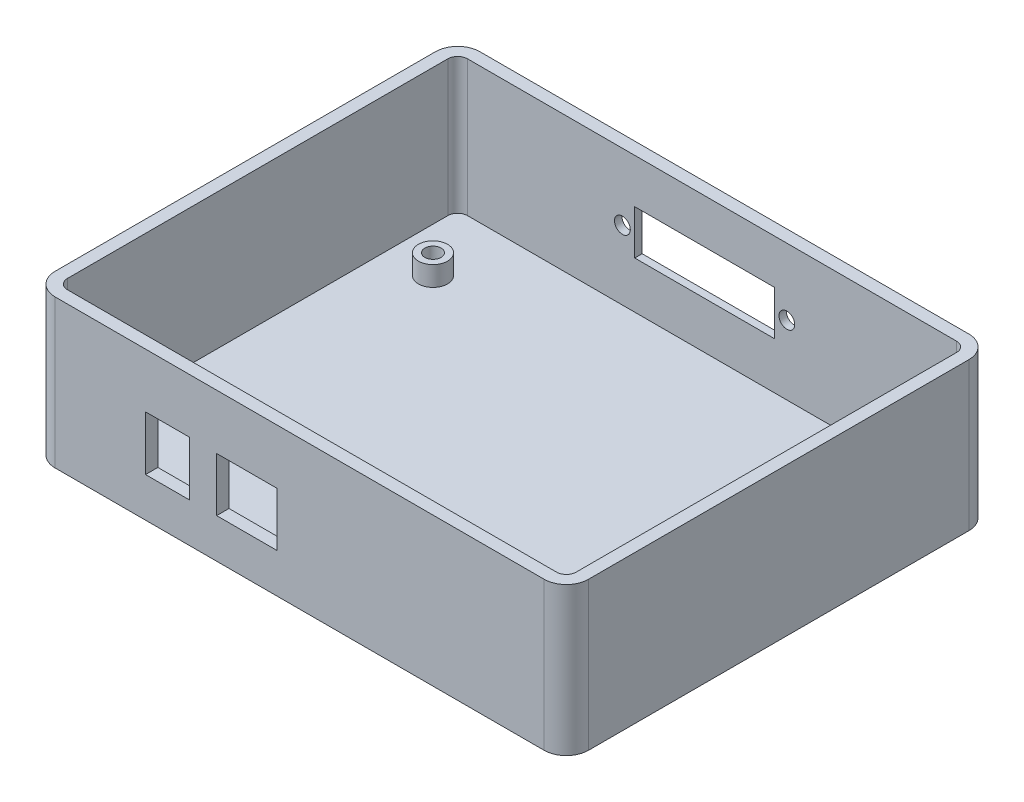
from build123d import *

# Parameters (mm, degrees)
SKETCH_1_W          = 103
SKETCH_1_H          = 81
SKETCH_1_R          = 1.65
EXTRUDE_1_DEPTH     = 2.5
FILLET_1_R          = 2
EXTRUDE_START       = -30
EXTRUDE_2_DEPTH     = 30
SKETCH_5_R          = 2.95
SKETCH_5_R_2        = 1.65
EXTRUDE_3_DEPTH     = 4
CUT_EXTRUDE_1_REACH = 108.66
SKETCH_6_W          = 8.9
SKETCH_6_H          = 11
SKETCH_6_W_2        = 12.2
SKETCH_6_H_2        = 10.9
CUT_EXTRUDE_2_REACH = 108.66
SKETCH_7_R          = 1.6
SKETCH_7_W          = 28.3
SKETCH_7_H          = 9
SKETCH_8_W          = 39.6
SKETCH_8_H          = 12.9
CUT_EXTRUDE_3_DEPTH = 1


with BuildPart() as part:
    # 草图1 → 凸台-拉伸1 (new body)
    with BuildSketch(Plane(origin=(0, 0, 0), x_dir=(1, 0, 0), z_dir=(0, 1, 0))):
        with Locations((1.5, 4.5)):
            Rectangle(SKETCH_1_W, SKETCH_1_H)
        with Locations((41, 31)):
            Circle(SKETCH_1_R, mode=Mode.SUBTRACT)
        with Locations((41, -31)):
            Circle(SKETCH_1_R, mode=Mode.SUBTRACT)
        with Locations((-41, -31)):
            Circle(SKETCH_1_R, mode=Mode.SUBTRACT)
        with Locations((-41, 31)):
            Circle(SKETCH_1_R, mode=Mode.SUBTRACT)
    extrude(amount=EXTRUDE_1_DEPTH)

    # 圆角1
    fillet_1_edges = [part.edges().sort_by_distance(p)[0] for p in [
        (53, 1.25, 36),
        (53, 1.25, -45),
        (-50, 1.25, 36),
        (-50, 1.25, -45),
    ]]
    fillet(fillet_1_edges, radius=FILLET_1_R)

    # 草图4 → 凸台-拉伸2 (add)
    with BuildSketch(Plane.XZ.offset(EXTRUDE_START)):
        with BuildLine():
            Line((51, 38.5), (-48, 38.5))
            ThreePointArc((-48, 38.5), (-51.181980515, 37.181980515), (-52.5, 34))
            Line((-52.5, 34), (-52.5, -43))
            ThreePointArc((-52.5, -43), (-51.181980515, -46.181980515), (-48, -47.5))
            Line((-48, -47.5), (51, -47.5))
            ThreePointArc((51, -47.5), (54.181980515, -46.181980515), (55.5, -43))
            Line((55.5, -43), (55.5, 34))
            ThreePointArc((55.5, 34), (54.181980515, 37.181980515), (51, 38.5))
        make_face()
        with BuildLine():
            Line((51, 36), (-48, 36))
            ThreePointArc((-48, 36), (-49.414213562, 35.414213562), (-50, 34))
            Line((-50, 34), (-50, -43))
            ThreePointArc((-50, -43), (-49.414213562, -44.414213562), (-48, -45))
            Line((-48, -45), (51, -45))
            ThreePointArc((51, -45), (52.414213562, -44.414213562), (53, -43))
            Line((53, -43), (53, 34))
            ThreePointArc((53, 34), (52.414213562, 35.414213562), (51, 36))
        make_face(mode=Mode.SUBTRACT)
    extrude(amount=EXTRUDE_2_DEPTH)

    # 草图5 → 凸台-拉伸3 (add)
    # profile 1 of 4: a face of its own
    with BuildSketch(Plane(origin=(0, 2.5, 0), x_dir=(1, 0, 0), z_dir=(0, 1, 0))):
        with Locations((-41, -31)):
            Circle(SKETCH_5_R)
        with Locations((-41, -31)):
            Circle(SKETCH_5_R_2, mode=Mode.SUBTRACT)
    # profile 2 of 4: a face of its own
    with BuildSketch(Plane(origin=(0, 2.5, 0), x_dir=(1, 0, 0), z_dir=(0, 1, 0))):
        with Locations((41, -31)):
            Circle(SKETCH_5_R)
        with Locations((41, -31)):
            Circle(SKETCH_5_R_2, mode=Mode.SUBTRACT)
    # profile 3 of 4: a face of its own
    with BuildSketch(Plane(origin=(0, 2.5, 0), x_dir=(1, 0, 0), z_dir=(0, 1, 0))):
        with Locations((41, 31)):
            Circle(SKETCH_5_R)
        with Locations((41, 31)):
            Circle(SKETCH_5_R_2, mode=Mode.SUBTRACT)
    # profile 4 of 4: a face of its own
    with BuildSketch(Plane(origin=(0, 2.5, 0), x_dir=(1, 0, 0), z_dir=(0, 1, 0))):
        with Locations((-41, 31)):
            Circle(SKETCH_5_R)
        with Locations((-41, 31)):
            Circle(SKETCH_5_R_2, mode=Mode.SUBTRACT)
    extrude(amount=EXTRUDE_3_DEPTH)

    # 草图6 → 切除-拉伸1 (cut, up to next)
    with BuildSketch(Plane.XY.offset(38.5), mode=Mode.PRIVATE) as cut_extrude_1_sk1:
        with Locations((-25.25, 13.5)):
            Rectangle(SKETCH_6_W, SKETCH_6_H)
    cut_extrude_1_tool1 = extrude(cut_extrude_1_sk1.sketch, amount=-CUT_EXTRUDE_1_REACH, mode=Mode.PRIVATE) & part.part
    # 草图6 → 切除-拉伸1 (cut, up to next)
    with BuildSketch(Plane.XY.offset(38.5), mode=Mode.PRIVATE) as cut_extrude_1_sk2:
        with Locations((-9.2, 13.45)):
            Rectangle(SKETCH_6_W_2, SKETCH_6_H_2)
    cut_extrude_1_tool2 = extrude(cut_extrude_1_sk2.sketch, amount=-CUT_EXTRUDE_1_REACH, mode=Mode.PRIVATE) & part.part
    add(cut_extrude_1_tool1.solids().sort_by_distance((-25.25, 13.5, 38.5))[0], mode=Mode.SUBTRACT)
    add(cut_extrude_1_tool2.solids().sort_by_distance((-9.2, 13.45, 38.5))[0], mode=Mode.SUBTRACT)

    # 草图7 → 切除-拉伸2 (cut, up to next)
    with BuildSketch(Plane(origin=(0, 0, -47.5), x_dir=(-1, 0, 0), z_dir=(0, 0, -1)), mode=Mode.PRIVATE) as cut_extrude_2_sk1:
        with Locations((-16.65, 16.5)):
            Circle(SKETCH_7_R)
    cut_extrude_2_tool1 = extrude(cut_extrude_2_sk1.sketch, amount=-CUT_EXTRUDE_2_REACH, mode=Mode.PRIVATE) & part.part
    # 草图7 → 切除-拉伸2 (cut, up to next)
    with BuildSketch(Plane(origin=(0, 0, -47.5), x_dir=(-1, 0, 0), z_dir=(0, 0, -1)), mode=Mode.PRIVATE) as cut_extrude_2_sk2:
        with Locations((16.65, 16.5)):
            Circle(SKETCH_7_R)
    cut_extrude_2_tool2 = extrude(cut_extrude_2_sk2.sketch, amount=-CUT_EXTRUDE_2_REACH, mode=Mode.PRIVATE) & part.part
    # 草图7 → 切除-拉伸2 (cut, up to next)
    with BuildSketch(Plane(origin=(0, 0, -47.5), x_dir=(-1, 0, 0), z_dir=(0, 0, -1)), mode=Mode.PRIVATE) as cut_extrude_2_sk3:
        with Locations((0, 16.5)):
            Rectangle(SKETCH_7_W, SKETCH_7_H)
    cut_extrude_2_tool3 = extrude(cut_extrude_2_sk3.sketch, amount=-CUT_EXTRUDE_2_REACH, mode=Mode.PRIVATE) & part.part
    add(cut_extrude_2_tool1.solids().sort_by_distance((16.65, 16.5, -47.5))[0], mode=Mode.SUBTRACT)
    add(cut_extrude_2_tool2.solids().sort_by_distance((-16.65, 16.5, -47.5))[0], mode=Mode.SUBTRACT)
    add(cut_extrude_2_tool3.solids().sort_by_distance((0, 16.5, -47.5))[0], mode=Mode.SUBTRACT)

    # 草图8 → 切除-拉伸3 (cut)
    with BuildSketch(Plane(origin=(0, 0, -47.5), x_dir=(-1, 0, 0), z_dir=(0, 0, -1))):
        with Locations((0, 16.5)):
            Rectangle(SKETCH_8_W, SKETCH_8_H)
    extrude(amount=-CUT_EXTRUDE_3_DEPTH, mode=Mode.SUBTRACT)


solid = part.part
